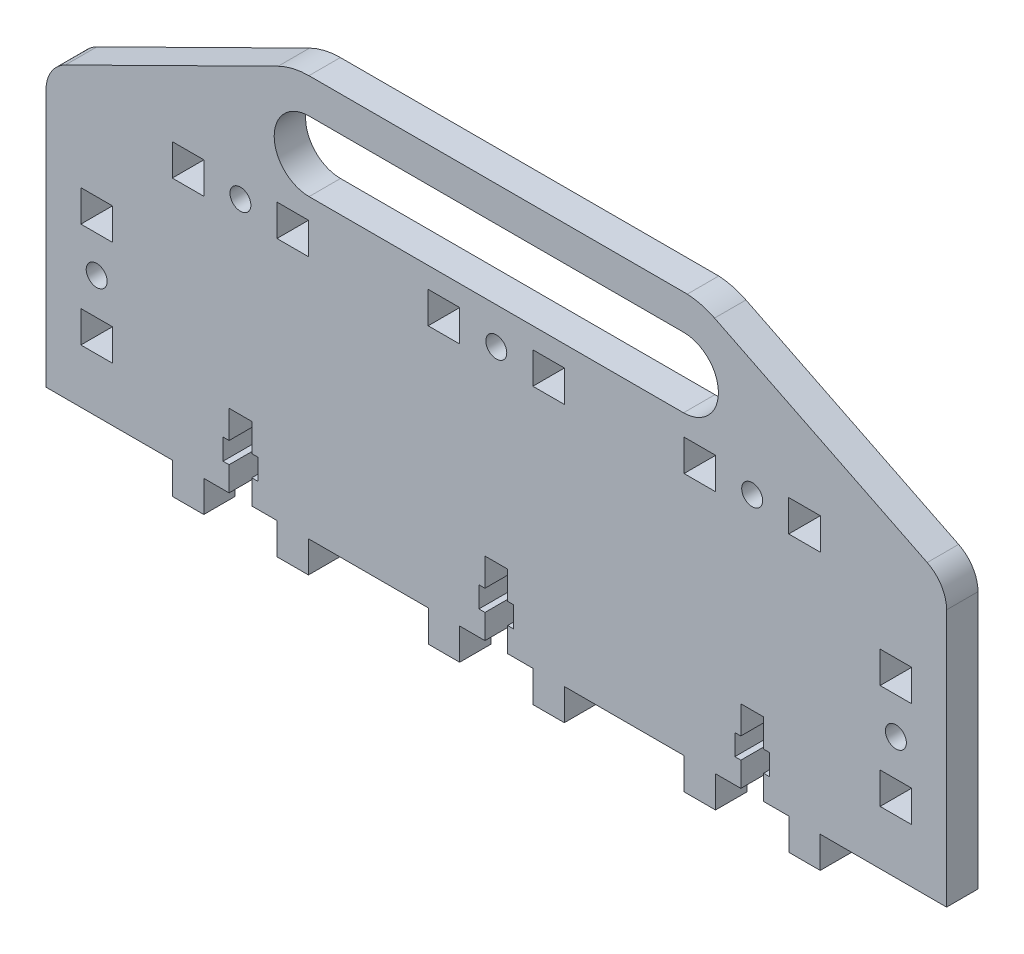
from build123d import *

# Parameters (mm, degrees)
SKETCH1_W           = 9.05
SKETCH1_H           = 9.05
SKETCH1_R           = 3
BOSS_EXTRUDE3_DEPTH = 9
FILLET3_R           = 10


with BuildPart() as part:
    # Sketch1 → Boss-Extrude3 (new body)
    with BuildSketch(Plane.XY):
        with BuildLine():
            Line((-129.05, 0), (-92.833333333, 0))
            Line((-92.833333333, 0), (-92.833333333, -9))
            Line((-92.833333333, -9), (-83.833333333, -9))
            Line((-83.833333333, -9), (-83.833333333, 0))
            Line((-83.833333333, 0), (-76.583333333, 0))
            Line((-76.583333333, 0), (-76.583333333, 7))
            Line((-76.583333333, 7), (-78.308333333, 7))
            Line((-78.308333333, 7), (-78.308333333, 13))
            Line((-78.308333333, 13), (-76.583333333, 13))
            Line((-76.583333333, 13), (-76.583333333, 21))
            Line((-76.583333333, 21), (-70.083333333, 21))
            Line((-70.083333333, 21), (-70.083333333, 13))
            Line((-70.083333333, 13), (-68.358333333, 13))
            Line((-68.358333333, 13), (-68.358333333, 7))
            Line((-68.358333333, 7), (-70.083333333, 7))
            Line((-70.083333333, 7), (-70.083333333, 0))
            Line((-70.083333333, 0), (-62.833333333, 0))
            Line((-62.833333333, 0), (-62.833333333, -9))
            Line((-62.833333333, -9), (-53.833333333, -9))
            Line((-53.833333333, -9), (-53.833333333, 0))
            Line((-53.833333333, 0), (-19.5, 0))
            Line((-19.5, 0), (-19.5, -9))
            Line((-19.5, -9), (-10.5, -9))
            Line((-10.5, -9), (-10.5, 0))
            Line((-10.5, 0), (-3.25, 0))
            Line((-3.25, 0), (-3.25, 7))
            Line((-3.25, 7), (-4.975, 7))
            Line((-4.975, 7), (-4.975, 13))
            Line((-4.975, 13), (-3.25, 13))
            Line((-3.25, 13), (-3.25, 21))
            Line((-3.25, 21), (3.25, 21))
            Line((3.25, 21), (3.25, 13))
            Line((3.25, 13), (4.975, 13))
            Line((4.975, 13), (4.975, 7))
            Line((4.975, 7), (3.25, 7))
            Line((3.25, 7), (3.25, 0))
            Line((3.25, 0), (10.5, 0))
            Line((10.5, 0), (10.5, -9))
            Line((10.5, -9), (19.5, -9))
            Line((19.5, -9), (19.5, 0))
            Line((19.5, 0), (53.833333333, 0))
            Line((53.833333333, 0), (53.833333333, -9))
            Line((53.833333333, -9), (62.833333333, -9))
            Line((62.833333333, -9), (62.833333333, 0))
            Line((62.833333333, 0), (70.083333333, 0))
            Line((70.083333333, 0), (70.083333333, 7))
            Line((70.083333333, 7), (68.358333333, 7))
            Line((68.358333333, 7), (68.358333333, 13))
            Line((68.358333333, 13), (70.083333333, 13))
            Line((70.083333333, 13), (70.083333333, 21))
            Line((70.083333333, 21), (76.583333333, 21))
            Line((76.583333333, 21), (76.583333333, 13))
            Line((76.583333333, 13), (78.308333333, 13))
            Line((78.308333333, 13), (78.308333333, 7))
            Line((78.308333333, 7), (76.583333333, 7))
            Line((76.583333333, 7), (76.583333333, 0))
            Line((76.583333333, 0), (83.833333333, 0))
            Line((83.833333333, 0), (83.833333333, -9))
            Line((83.833333333, -9), (92.833333333, -9))
            Line((92.833333333, -9), (92.833333333, 0))
            Line((92.833333333, 0), (129.05, 0))
            Line((129.05, 0), (129.05, 80))
            Line((129.05, 80), (62.547113658, 112.947672043))
            ThreePointArc((62.547113658, 112.947672043), (58.749668323, 114.370880365), (54.743383075, 115))
            Line((54.743383075, 115), (-53.690843803, 115))
            ThreePointArc((-53.690843803, 115), (-58.228133857, 114.470235748), (-62.526861763, 112.924729491))
            Line((-62.526861763, 112.924729491), (-129.05, 80))
            Line((-129.05, 80), (-129.05, 0))
        make_face()
        with Locations((-114.525, 20)):
            Rectangle(SKETCH1_W, SKETCH1_H, mode=Mode.SUBTRACT)
        with Locations((-114.525, 35)):
            Circle(SKETCH1_R, mode=Mode.SUBTRACT)
        with Locations((-114.525, 50)):
            Rectangle(SKETCH1_W, SKETCH1_H, mode=Mode.SUBTRACT)
        with Locations((114.525, 20)):
            Rectangle(SKETCH1_W, SKETCH1_H, mode=Mode.SUBTRACT)
        with Locations((114.525, 35)):
            Circle(SKETCH1_R, mode=Mode.SUBTRACT)
        with Locations((114.525, 50)):
            Rectangle(SKETCH1_W, SKETCH1_H, mode=Mode.SUBTRACT)
        with Locations((-88.333333333, 74.525)):
            Rectangle(SKETCH1_W, SKETCH1_H, mode=Mode.SUBTRACT)
        with Locations((-73.333333333, 74.525)):
            Circle(SKETCH1_R, mode=Mode.SUBTRACT)
        with Locations((-58.333333333, 74.525)):
            Rectangle(SKETCH1_W, SKETCH1_H, mode=Mode.SUBTRACT)
        with Locations((-15, 74.525)):
            Rectangle(SKETCH1_W, SKETCH1_H, mode=Mode.SUBTRACT)
        with BuildLine():
            ThreePointArc((-53.655258809, 85), (-63.655258809, 95), (-53.655258809, 105))
            Line((-53.655258809, 105), (53.655258809, 105))
            ThreePointArc((53.655258809, 105), (63.655258809, 95), (53.655258809, 85))
            Line((53.655258809, 85), (-53.655258809, 85))
        make_face(mode=Mode.SUBTRACT)
        with Locations((0, 74.525)):
            Circle(SKETCH1_R, mode=Mode.SUBTRACT)
        with Locations((15, 74.525)):
            Rectangle(SKETCH1_W, SKETCH1_H, mode=Mode.SUBTRACT)
        with Locations((58.333333333, 74.525)):
            Rectangle(SKETCH1_W, SKETCH1_H, mode=Mode.SUBTRACT)
        with Locations((73.333333333, 74.525)):
            Circle(SKETCH1_R, mode=Mode.SUBTRACT)
        with Locations((88.333333333, 74.525)):
            Rectangle(SKETCH1_W, SKETCH1_H, mode=Mode.SUBTRACT)
    extrude(amount=BOSS_EXTRUDE3_DEPTH)

    # Fillet3
    fillet3_edges = [part.edges().sort_by_distance(p)[0] for p in [
        (-129.05, 80, 4.5),
        (129.05, 80, 4.5),
    ]]
    fillet(fillet3_edges, radius=FILLET3_R)


solid = part.part
